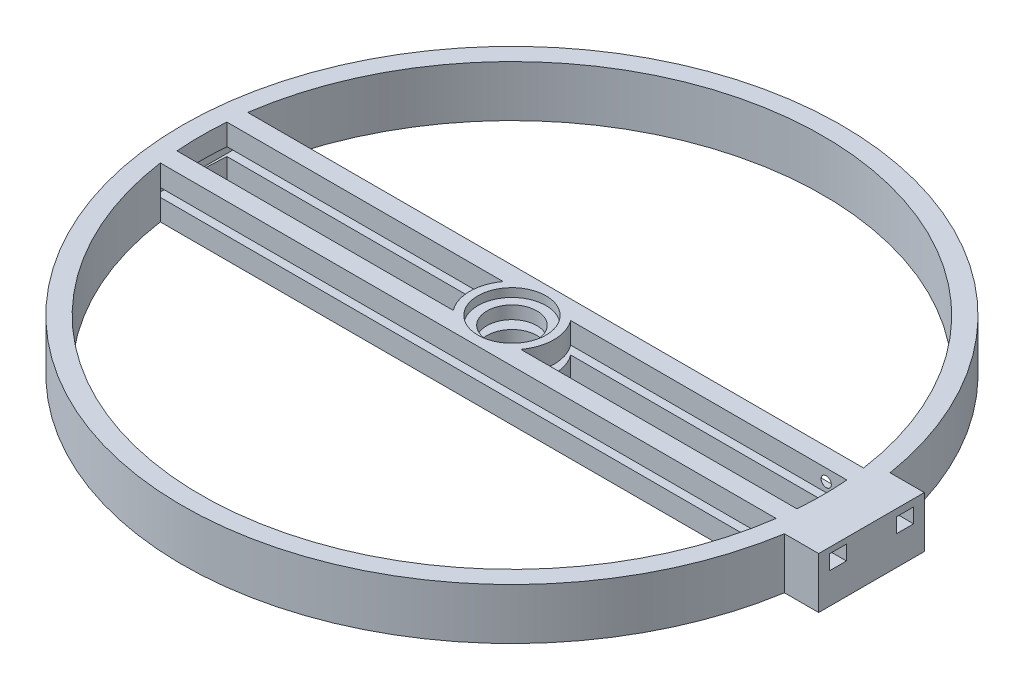
from build123d import *

# Parameters (mm, degrees)
SKETCH1_R           = 463.544695529
BOSS_EXTRUDE2_DEPTH = 76.2
EXTRUDE_THIN1_DEPTH = 76.2
SKETCH3_R           = 37.22133085
BOSS_EXTRUDE3_DEPTH = 76.2
SKETCH4_W           = 925.4067294
SKETCH4_H           = 12.7
CUT_EXTRUDE1_DEPTH  = 130.322661699
SKETCH5_R           = 50.8
CUT_EXTRUDE2_DEPTH  = 12.7
CUT_EXTRUDE3_START  = -7.62
SKETCH6_R           = 50.8
CUT_EXTRUDE3_DEPTH  = 7.62
SKETCH8_W           = 25.4
SKETCH8_H           = 21.854781484
SKETCH8_H_2         = 21.84327291
CUT_EXTRUDE4_DEPTH  = 152.4
SKETCH9_R           = 7.62
CUT_EXTRUDE5_DEPTH  = 127


# Read off the part's stored shape, not the designer's step: Extrude-Thin1
with BuildPart() as part:
    # Sketch1 → Boss-Extrude2 (new body)
    with BuildSketch(Plane(origin=(0, 0, 0), x_dir=(1, 0, 0), z_dir=(0, 1, 0))):
        with BuildLine():
            Line((533.4, -76.2), (533.4, 76.2))
            Line((533.4, 76.2), (482.762143569, 76.2))
            ThreePointArc((482.762143569, 76.2), (-488.738915233, 0), (482.762143569, -76.2))
            Line((482.762143569, -76.2), (533.4, -76.2))
        make_face()
        with Locations(Location((0, 0, 0), (0, 0, 90))):
            Circle(SKETCH1_R, mode=Mode.SUBTRACT)
    extrude(amount=BOSS_EXTRUDE2_DEPTH)

    # Extrude-Thin1 outline → Extrude-Thin1 (add)
    with BuildSketch(Plane(origin=(0, 0, 0), x_dir=(1, 0, 0), z_dir=(0, 1, 0))):
        with BuildLine():
            Line((535.94, -78.74), (535.94, 78.74))
            Line((535.94, 78.74), (484.927814167, 78.74))
            ThreePointArc((484.927814167, 78.74), (-491.278915233, 0), (484.927814167, -78.74))
            Line((484.927814167, -78.74), (535.94, -78.74))
        make_face()
        with BuildLine():
            ThreePointArc((482.762143569, -76.2), (-488.738915233, 0), (482.762143569, 76.2))
            Line((482.762143569, 76.2), (533.4, 76.2))
            Line((533.4, 76.2), (533.4, -76.2))
            Line((533.4, -76.2), (482.762143569, -76.2))
        make_face(mode=Mode.SUBTRACT)
    extrude(amount=EXTRUDE_THIN1_DEPTH)

    # Sketch3 → Boss-Extrude3 (add)
    with BuildSketch(Plane(origin=(0, 0, 0), x_dir=(1, 0, 0), z_dir=(0, 1, 0))):
        with BuildLine():
            Line((50.358749063, 37.22133085), (464.47679922, 37.22133085))
            ThreePointArc((464.47679922, 37.22133085), (463.142727121, 51.21463461), (461.387175207, 65.16133085))
            Line((461.387175207, 65.16133085), (-461.387175207, 65.16133085))
            ThreePointArc((-461.387175207, 65.16133085), (-463.142727121, 51.21463461), (-464.47679922, 37.22133085))
            Line((-464.47679922, 37.22133085), (-50.358749063, 37.22133085))
            ThreePointArc((-50.358749063, 37.22133085), (-62.62133085, 0), (-50.358749063, -37.22133085))
            Line((-50.358749063, -37.22133085), (-464.47679922, -37.22133085))
            ThreePointArc((-464.47679922, -37.22133085), (-463.142727121, -51.21463461), (-461.387175207, -65.16133085))
            Line((-461.387175207, -65.16133085), (461.387175207, -65.16133085))
            ThreePointArc((461.387175207, -65.16133085), (463.142727121, -51.21463461), (464.47679922, -37.22133085))
            Line((464.47679922, -37.22133085), (50.358749063, -37.22133085))
            ThreePointArc((50.358749063, -37.22133085), (62.62133085, 0), (50.358749063, 37.22133085))
        make_face()
        with Locations(Location((0, 0, 0), (0, 0, 90))):
            Circle(SKETCH3_R, mode=Mode.SUBTRACT)
    extrude(amount=BOSS_EXTRUDE3_DEPTH)

    # Sketch4 → Cut-Extrude1 (cut)
    with BuildSketch(Plane.XY.offset(65.16133085)):
        with Locations((-3.175550533, 38.1)):
            Rectangle(SKETCH4_W, SKETCH4_H)
    extrude(amount=-CUT_EXTRUDE1_DEPTH, mode=Mode.SUBTRACT)

    # Sketch5 → Cut-Extrude2 (cut)
    with BuildSketch(Plane(origin=(0, 76.2, 0), x_dir=(1, 0, 0), z_dir=(0, 1, 0))):
        with Locations(Location((0, 0, 0), (0, 0, 270))):
            Circle(SKETCH5_R)
    extrude(amount=-CUT_EXTRUDE2_DEPTH, mode=Mode.SUBTRACT)

    # Sketch6 → Cut-Extrude3 (cut)
    with BuildSketch(Plane.XZ.offset(CUT_EXTRUDE3_START)):
        with Locations(Location((0, 0, 0), (0, 0, 90))):
            Circle(SKETCH6_R)
    extrude(amount=CUT_EXTRUDE3_DEPTH, mode=Mode.SUBTRACT)

    # Sketch8 → Cut-Extrude4 (cut)
    with BuildSketch(Plane(origin=(535.94, 0, 0), x_dir=(0, 0, -1), z_dir=(1, 0, 0))):
        with Locations((50.038, 54.731390154)):
            Rectangle(SKETCH8_W, SKETCH8_H)
        with Locations((-50.038, 56.82595057)):
            Rectangle(SKETCH8_W, SKETCH8_H_2)
    extrude(amount=-CUT_EXTRUDE4_DEPTH, mode=Mode.SUBTRACT)

    # Sketch9 → Cut-Extrude5 (cut)
    with BuildSketch(Plane(origin=(0, 0, -65.16133085), x_dir=(-1, 0, 0), z_dir=(0, 0, -1))):
        with Locations((-431.199928215, 58.518904378)):
            Circle(SKETCH9_R)
    extrude(amount=-CUT_EXTRUDE5_DEPTH, mode=Mode.SUBTRACT)


solid = part.part
